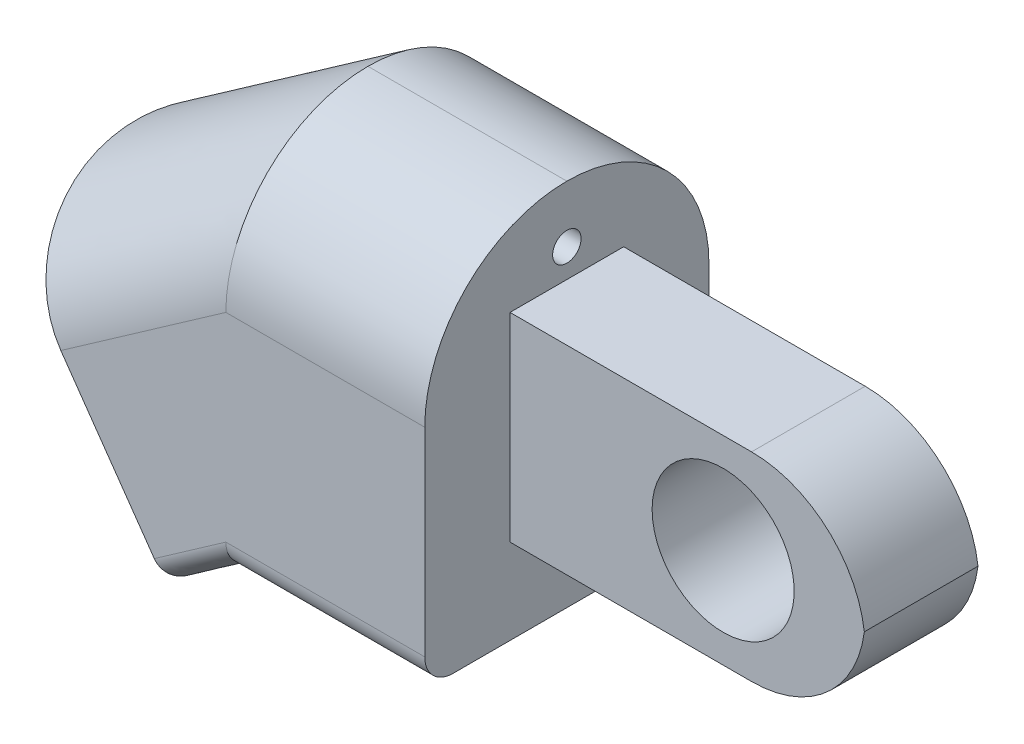
from build123d import *

# Parameters (mm, degrees)
SKETCH1_W            = 15.875
SKETCH1_H            = 8.89
SKETCH1_R            = 3.175
BOSS_EXTRUDE1_DEPTH  = 5.08
FILLET1_R            = 5.08
SKETCH2_W            = 12.7
SKETCH2_H            = 16.51
SKETCH2_W_2          = 5.08
SKETCH2_H_2          = 8.89
BOSS_EXTRUDE2_DEPTH  = 8.89
FILLET3_R            = 6.35
SKETCH3_W            = 10.795
SKETCH3_H            = 5.08
BOSS_EXTRUDE3_DEPTH  = 2.54
SKETCH4_R            = 0.635
CUT_EXTRUDE1_DEPTH   = 38.534765549
FILLET6_R            = 1.27
FILLET7_R            = 1.905
SKETCH8_W            = 23.264447617
SKETCH8_H            = 19.052246488
CUT_EXTRUDE3_DEPTH   = 28.541068906
BOSS_EXTRUDE9_REACH  = 36.447
SKETCH9_RX           = 0.635
SKETCH9_RY           = 0.520161548
BOSS_EXTRUDE10_DEPTH = 3.175
SKETCH11_R           = 1.905
CUT_EXTRUDE4_DEPTH   = 5.08


# Some blends are built 0.0001 mm under size
with BuildPart() as part:
    # Sketch1 → Boss-Extrude1 (new body)
    with BuildSketch(Plane.XY):
        with Locations((1.5875, 0)):
            Rectangle(SKETCH1_W, SKETCH1_H)
        Circle(SKETCH1_R, mode=Mode.SUBTRACT)
    extrude(amount=BOSS_EXTRUDE1_DEPTH)

    # Fillet1
    # the kernel refuses this fillet: 5.08 mm, written as the material it takes off along each edge
    with BuildSketch(Plane(origin=(-6.35, -4.445, -12.7), x_dir=(1, 0, 0), z_dir=(0, 0, 1))) as fillet1_piece_1:
        with BuildLine():
            CenterArc((FILLET1_R, FILLET1_R), FILLET1_R, 180, 90)
            Line((0, FILLET1_R), (0, 0))
            Line((0, 0), (FILLET1_R, 0))
        make_face()
    extrude(amount=30.48, mode=Mode.SUBTRACT)
    with BuildSketch(Plane(origin=(-6.35, 4.445, -12.7), x_dir=(1, 0, 0), z_dir=(0, 0, 1))) as fillet1_piece_2:
        with BuildLine():
            CenterArc((FILLET1_R, -FILLET1_R), FILLET1_R, 90, 90)
            Line((0, -FILLET1_R), (0, 0))
            Line((0, 0), (FILLET1_R, 0))
        make_face()
    extrude(amount=30.48, mode=Mode.SUBTRACT)


with BuildPart() as body_2:
    # Sketch2 → Boss-Extrude2 (new body)
    # profile 1 of 3: a face of its own
    with BuildSketch(Plane(origin=(9.525, 0, 0), x_dir=(0, 0, -1), z_dir=(1, 0, 0))):
        with Locations((-2.54, 0)):
            Rectangle(SKETCH2_W, SKETCH2_H)
        with Locations((-2.54, 0)):
            Rectangle(SKETCH2_W_2, SKETCH2_H_2, mode=Mode.SUBTRACT)
    # profile 2 of 3: a face of its own
    with BuildSketch(Plane(origin=(9.525, 0, 0), x_dir=(0, 0, -1), z_dir=(1, 0, 0))):
        with Locations((-2.54, 0)):
            Rectangle(SKETCH2_W_2, SKETCH2_H_2)
    # profile 3 of 3: a face of its own
    with BuildSketch(Plane(origin=(9.525, 0, 0), x_dir=(0, 0, -1), z_dir=(1, 0, 0))):
        with Locations((-2.54, 0)):
            Rectangle(SKETCH2_W_2, SKETCH2_H_2)
    extrude(amount=BOSS_EXTRUDE2_DEPTH)

    # Fillet3
    fillet3_edges = [body_2.edges().sort_by_distance(p)[0] for p in [
        (13.97, 8.255, -3.81),
        (13.97, 8.255, 8.89),
    ]]
    fillet(fillet3_edges, radius=FILLET3_R - 0.0001)  # a hair under: the kernel refuses the full size


with BuildPart() as body_3:
    # Mirror7: mirrored copy
    add(part.part.mirror(Plane.ZY.offset(-13.97)))


with BuildPart() as part_1:
    add(part.part)

    add(body_2.part)  # Boss-Extrude3 merges body 2
    # Sketch3 → Boss-Extrude3 (add)
    with BuildSketch(Plane(origin=(0, 4.445, 0), x_dir=(1, 0, 0), z_dir=(0, 1, 0))):
        with Locations((4.1275, -2.54)):
            Rectangle(SKETCH3_W, SKETCH3_H)
    extrude(amount=BOSS_EXTRUDE3_DEPTH)

    # Sketch4 → Cut-Extrude1 (cut, through all)
    with BuildSketch(Plane.ZY.offset(1.27)):
        with Locations(Location((2.54, 5.715, 0), (0, 0, 270))):
            Circle(SKETCH4_R)
    extrude(amount=-CUT_EXTRUDE1_DEPTH, mode=Mode.SUBTRACT)

    # Fillet6
    fillet6_edges = [part_1.edges().sort_by_distance(p)[0] for p in [
        (13.97, -8.255, 8.89),
        (13.97, -8.255, -3.81),
    ]]
    fillet(fillet6_edges, radius=FILLET6_R)

    # Fillet7
    fillet7_edges = [part_1.edges().sort_by_distance(p)[0] for p in [
        (4.1275, 6.985, 0),
        (4.1275, 6.985, 5.08),
    ]]
    fillet(fillet7_edges, radius=FILLET7_R)

    # Sketch8 → Cut-Extrude3 (cut, through all)
    with BuildSketch(Plane.ZY.offset(-9.525)):
        with Locations((0.549383954, -0.09933187)):
            Rectangle(SKETCH8_W, SKETCH8_H)
    extrude(amount=CUT_EXTRUDE3_DEPTH, mode=Mode.SUBTRACT)

    # Boss-Extrude9: up to this face of the body (flat: up to its plane)
    boss_extrude9_end = Plane(part_1.part.faces().sort_by_distance((9.525, -0.630403153, 2.54))[0])
    # Sketch9 → Boss-Extrude9 (add, up to the picked face)
    with BuildSketch(Plane(origin=(2.51278964, 1.759474248, 0), x_dir=(0, 0, -1), z_dir=(-0.8191520442889908, -0.5735764363510476, 0)), mode=Mode.PRIVATE) as boss_extrude9_sk1:
        with BuildLine():
            Line((3.81, 3.902830912), (3.81, 11.185092586))
            add(Edge.make_bspline(
                [(3.81, 11.185092586), (3.81, 12.225415682), (2.54, 12.225415682)],
                knots=[0, 0, 0, 1.570796327, 1.570796327, 1.570796327], degree=2, weights=[1, 0.707106781, 1]))
            Line((2.54, 12.225415682), (-7.62, 12.225415682))
            add(Edge.make_bspline(
                [(-7.62, 12.225415682), (-8.89, 12.225415682), (-8.89, 11.185092586)],
                knots=[4.71238898, 4.71238898, 4.71238898, 6.283185307, 6.283185307, 6.283185307], degree=2, weights=[1, 0.707106781, 1]))
            Line((-8.89, 11.185092586), (-8.89, 3.902830912))
            add(Edge.make_bspline(
                [(-8.89, 3.902830912), (-8.89, -1.298784569), (-2.54, -1.298784569)],
                knots=[0, 0, 0, 1.570796327, 1.570796327, 1.570796327], degree=2, weights=[1, 0.707106781, 1]))
            add(Edge.make_bspline(
                [(-2.54, -1.298784569), (3.81, -1.298784569), (3.81, 3.902830912)],
                knots=[1.570796327, 1.570796327, 1.570796327, 3.141592654, 3.141592654, 3.141592654], degree=2, weights=[1, 0.707106781, 1]))
        make_face()
        with Locations((-2.54, 0.781861623)):
            Ellipse(SKETCH9_RX, SKETCH9_RY, mode=Mode.SUBTRACT)
    boss_extrude9_tool1 = split(extrude(boss_extrude9_sk1.sketch, amount=-BOSS_EXTRUDE9_REACH, mode=Mode.PRIVATE), bisect_by=boss_extrude9_end, keep=Keep.BOTH, mode=Mode.PRIVATE)
    add(boss_extrude9_tool1.solids().sort_by(Axis((5.94262, -3.138832, 2.54), (0.8191520442889908, 0.5735764363510476, 0)))[0])

    # Sketch10 → Boss-Extrude10 (add)
    with BuildSketch(Plane(origin=(2.51278964, 1.759474248, 0), x_dir=(0, 0, 1), z_dir=(-0.8191520442889908, -0.5735764363510477, 0))):
        with BuildLine():
            add(Edge.make_bspline(
                [(2.54, 1.298784569), (-3.81, 1.298784569), (-3.81, -3.902830912)],
                knots=[1.570796327, 1.570796327, 1.570796327, 3.141592654, 3.141592654, 3.141592654], degree=2, weights=[1, 0.707106781, 1]))
            Line((-3.81, -3.902830912), (-3.81, -11.185092586))
            add(Edge.make_bspline(
                [(-3.81, -11.185092586), (-3.81, -12.225415682), (-2.54, -12.225415682)],
                knots=[0, 0, 0, 1.570796327, 1.570796327, 1.570796327], degree=2, weights=[1, 0.707106781, 1]))
            Line((-2.54, -12.225415682), (7.62, -12.225415682))
            add(Edge.make_bspline(
                [(7.62, -12.225415682), (8.89, -12.225415682), (8.89, -11.185092586)],
                knots=[4.71238898, 4.71238898, 4.71238898, 6.283185307, 6.283185307, 6.283185307], degree=2, weights=[1, 0.707106781, 1]))
            Line((8.89, -11.185092586), (8.89, -3.902830912))
            add(Edge.make_bspline(
                [(8.89, -3.902830912), (8.89, 1.298784569), (2.54, 1.298784569)],
                knots=[0, 0, 0, 1.570796327, 1.570796327, 1.570796327], degree=2, weights=[1, 0.707106781, 1]))
        make_face()
        with BuildLine():
            ThreePointArc((1.495787578, -10.143789478), (1.327396698, -10.079733018), (1.162910292, -10.006228318))
            Line((1.162910292, -10.006228318), (0.815950926, -10.377285184))
            Line((0.815950926, -10.377285184), (0.930898118, -9.882460828))
            ThreePointArc((0.930898118, -9.882460828), (0.778239616, -9.786783765), (0.631253826, -9.68260173))
            Line((0.631253826, -9.68260173), (0.218571584, -9.978840429))
            Line((0.218571584, -9.978840429), (0.427845541, -9.515949069))
            ThreePointArc((0.427845541, -9.515949069), (0.296785998, -9.392328217), (0.172949406, -9.261472506))
            Line((0.172949406, -9.261472506), (-0.289596567, -9.471508749))
            Line((-0.289596567, -9.471508749), (0.005961874, -9.058339041))
            ThreePointArc((0.005961874, -9.058339041), (-0.098462164, -8.911525081), (-0.194390588, -8.759024405))
            Line((-0.194390588, -8.759024405), (-0.689024908, -8.874786618))
            Line((-0.689024908, -8.874786618), (-0.318540128, -8.527216441))
            ThreePointArc((-0.318540128, -8.527216441), (-0.392315705, -8.362851351), (-0.456649485, -8.194566226))
            Line((-0.456649485, -8.194566226), (-0.964363632, -8.211605731))
            Line((-0.964363632, -8.211605731), (-0.533190036, -7.942992013))
            ThreePointArc((-0.533190036, -7.942992013), (-0.573481997, -7.767392251), (-0.603748823, -7.589789779))
            Line((-0.603748823, -7.589789779), (-1.105031628, -7.507451759))
            Line((-1.105031628, -7.507451759), (-0.629738974, -7.328117174))
            ThreePointArc((-0.629738974, -7.328117174), (-0.634998923, -7.14803094), (-0.630035657, -6.967936285))
            Line((-0.630035657, -6.967936285), (-1.105623102, -6.789384943))
            Line((-1.105623102, -6.789384943), (-0.604476622, -6.706221219))
            ThreePointArc((-0.604476622, -6.706221219), (-0.57450242, -6.528569126), (-0.534499798, -6.352903225))
            Line((-0.534499798, -6.352903225), (-0.966115325, -6.085000189))
            Line((-0.966115325, -6.085000189), (-0.458373796, -6.10120326))
            ThreePointArc((-0.458373796, -6.10120326), (-0.394317337, -5.93281238), (-0.320812636, -5.768325974))
            Line((-0.320812636, -5.768325974), (-0.691869502, -5.421366608))
            Line((-0.691869502, -5.421366608), (-0.197045146, -5.5363138))
            ThreePointArc((-0.197045146, -5.5363138), (-0.101368083, -5.383655298), (0.002813951, -5.236669508))
            Line((0.002813951, -5.236669508), (-0.293424747, -4.823987265))
            Line((-0.293424747, -4.823987265), (0.169466613, -5.033261222))
            ThreePointArc((0.169466613, -5.033261222), (0.293087465, -4.90220168), (0.423943176, -4.778365088))
            Line((0.423943176, -4.778365088), (0.213906933, -4.315819115))
            Line((0.213906933, -4.315819115), (0.627076641, -4.611377556))
            ThreePointArc((0.627076641, -4.611377556), (0.773890601, -4.506953518), (0.926391277, -4.411025094))
            Line((0.926391277, -4.411025094), (0.810629064, -3.916390774))
            Line((0.810629064, -3.916390774), (1.158199241, -4.286875554))
            ThreePointArc((1.158199241, -4.286875554), (1.322564331, -4.213099977), (1.490849456, -4.148766197))
            Line((1.490849456, -4.148766197), (1.473809951, -3.64105205))
            Line((1.473809951, -3.64105205), (1.742423669, -4.072225646))
            ThreePointArc((1.742423669, -4.072225646), (1.918023431, -4.031933685), (2.095625903, -4.001666859))
            Line((2.095625903, -4.001666859), (2.177963923, -3.500384054))
            Line((2.177963923, -3.500384054), (2.357298508, -3.975676708))
            ThreePointArc((2.357298508, -3.975676708), (2.537384742, -3.970416759), (2.717479397, -3.975380025))
            Line((2.717479397, -3.975380025), (2.896030739, -3.49979258))
            Line((2.896030739, -3.49979258), (2.979194463, -4.00093906))
            ThreePointArc((2.979194463, -4.00093906), (3.156846556, -4.030913261), (3.332512457, -4.070915884))
            Line((3.332512457, -4.070915884), (3.600415493, -3.639300357))
            Line((3.600415493, -3.639300357), (3.584212422, -4.147041886))
            ThreePointArc((3.584212422, -4.147041886), (3.752603302, -4.211098345), (3.917089708, -4.284603046))
            Line((3.917089708, -4.284603046), (4.264049074, -3.91354618))
            Line((4.264049074, -3.91354618), (4.149101882, -4.408370535))
            ThreePointArc((4.149101882, -4.408370535), (4.301760384, -4.504047599), (4.448746174, -4.608229633))
            Line((4.448746174, -4.608229633), (4.861428416, -4.311990935))
            Line((4.861428416, -4.311990935), (4.652154459, -4.774882295))
            ThreePointArc((4.652154459, -4.774882295), (4.783214002, -4.898503147), (4.907050594, -5.029358857))
            Line((4.907050594, -5.029358857), (5.369596567, -4.819322614))
            Line((5.369596567, -4.819322614), (5.074038126, -5.232492323))
            ThreePointArc((5.074038126, -5.232492323), (5.178462164, -5.379306283), (5.274390588, -5.531806959))
            Line((5.274390588, -5.531806959), (5.769024908, -5.416044746))
            Line((5.769024908, -5.416044746), (5.398540128, -5.763614923))
            ThreePointArc((5.398540128, -5.763614923), (5.472315705, -5.927980013), (5.536649485, -6.096265138))
            Line((5.536649485, -6.096265138), (6.044363632, -6.079225632))
            Line((6.044363632, -6.079225632), (5.613190036, -6.347839351))
            ThreePointArc((5.613190036, -6.347839351), (5.653481997, -6.523439113), (5.683748823, -6.701041585))
            Line((5.683748823, -6.701041585), (6.185031628, -6.783379605))
            Line((6.185031628, -6.783379605), (5.709738974, -6.96271419))
            ThreePointArc((5.709738974, -6.96271419), (5.713684471, -7.05402707), (5.715, -7.145415682))
            ThreePointArc((5.715, -7.145415682), (5.713758671, -7.234190088), (5.710035657, -7.322895079))
            Line((5.710035657, -7.322895079), (6.185623102, -7.50144642))
            Line((6.185623102, -7.50144642), (5.684476622, -7.584610145))
            ThreePointArc((5.684476622, -7.584610145), (5.65450242, -7.762262238), (5.614499798, -7.937928139))
            Line((5.614499798, -7.937928139), (6.046115325, -8.205831175))
            Line((6.046115325, -8.205831175), (5.538373796, -8.189628103))
            ThreePointArc((5.538373796, -8.189628103), (5.474317337, -8.358018984), (5.400812636, -8.52250539))
            Line((5.400812636, -8.52250539), (5.771869502, -8.869464756))
            Line((5.771869502, -8.869464756), (5.277045146, -8.754517564))
            ThreePointArc((5.277045146, -8.754517564), (5.181368083, -8.907176066), (5.077186049, -9.054161855))
            Line((5.077186049, -9.054161855), (5.373424747, -9.466844098))
            Line((5.373424747, -9.466844098), (4.910533387, -9.257570141))
            ThreePointArc((4.910533387, -9.257570141), (4.786912535, -9.388629684), (4.656056824, -9.512466276))
            Line((4.656056824, -9.512466276), (4.866093067, -9.975012249))
            Line((4.866093067, -9.975012249), (4.452923359, -9.679453807))
            ThreePointArc((4.452923359, -9.679453807), (4.306109399, -9.783877846), (4.153608723, -9.87980627))
            Line((4.153608723, -9.87980627), (4.269370936, -10.374440589))
            Line((4.269370936, -10.374440589), (3.921800759, -10.00395581))
            ThreePointArc((3.921800759, -10.00395581), (3.757435669, -10.077731387), (3.589150544, -10.142065167))
            Line((3.589150544, -10.142065167), (3.606190049, -10.649779314))
            Line((3.606190049, -10.649779314), (3.337576331, -10.218605718))
            ThreePointArc((3.337576331, -10.218605718), (3.161976569, -10.258897679), (2.984374097, -10.289164505))
            Line((2.984374097, -10.289164505), (2.902036077, -10.79044731))
            Line((2.902036077, -10.79044731), (2.722701492, -10.315154656))
            ThreePointArc((2.722701492, -10.315154656), (2.542615258, -10.320414605), (2.362520603, -10.315451338))
            Line((2.362520603, -10.315451338), (2.183969261, -10.791038784))
            Line((2.183969261, -10.791038784), (2.100805537, -10.289892303))
            ThreePointArc((2.100805537, -10.289892303), (1.923153444, -10.259918102), (1.747487543, -10.219915479))
            Line((1.747487543, -10.219915479), (1.479584507, -10.651531007))
            Line((1.479584507, -10.651531007), (1.495787578, -10.143789478))
        make_face(mode=Mode.SUBTRACT)
        with BuildLine():
            add(Edge.make_bspline(
                [(1.905, -0.781861623), (1.905, -1.682807853), (2.8575, -1.232334738), (3.81, -0.781861623), (2.8575, -0.331388508), (1.905, 0.119084606), (1.905, -0.781861623)],
                knots=[0, 0, 0, 2.094395102, 2.094395102, 4.188790205, 4.188790205, 6.283185307, 6.283185307, 6.283185307], degree=2, weights=[1, 0.5, 1, 0.5, 1, 0.5, 1]))
        make_face(mode=Mode.SUBTRACT)
    extrude(amount=BOSS_EXTRUDE10_DEPTH)

    # Sketch11 → Cut-Extrude4 (cut)
    with BuildSketch(Plane(origin=(2.51278964, 1.759474248, 0), x_dir=(0, 0, 1), z_dir=(-0.8191520442889908, -0.5735764363510477, 0))):
        with Locations(Location((2.54, -7.145415682, 0), (0, 0, 270))):
            Circle(SKETCH11_R)
    extrude(amount=-CUT_EXTRUDE4_DEPTH, mode=Mode.SUBTRACT)


solid = Compound([body_3.part, part_1.part])
